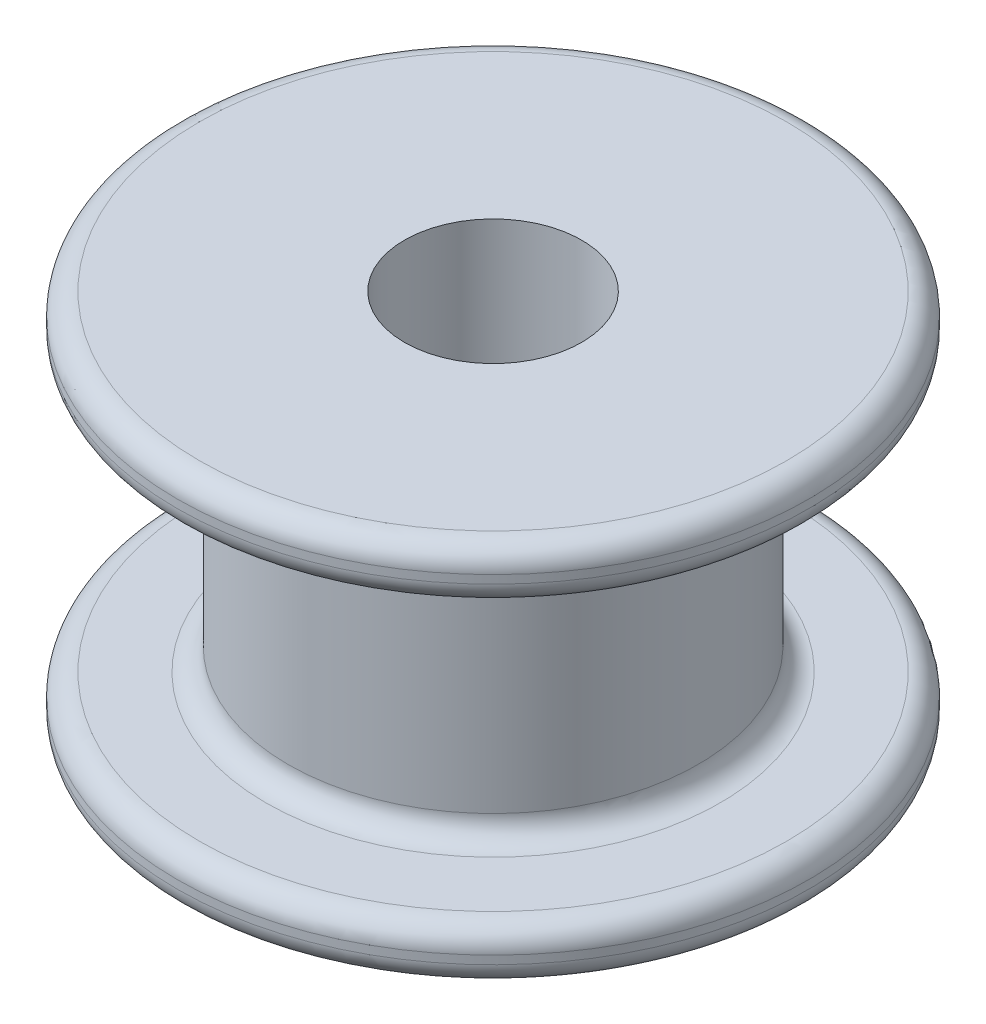
from build123d import *


with BuildPart() as part:
    # Sketch3 → Revolve1 (revolve)
    with BuildSketch(Plane(origin=(0, 0, 0), x_dir=(0, 0, -1), z_dir=(1, 0, 0))):
        with BuildLine():
            Line((8, 0), (8, 17.25))
            Line((8, 17.25), (26.5, 17.25))
            ThreePointArc((26.5, 17.25), (27.914213562, 16.664213562), (28.5, 15.25))
            Line((28.5, 15.25), (28.5, 14.5))
            ThreePointArc((28.5, 14.5), (27.914213562, 13.085786438), (26.5, 12.5))
            Line((26.5, 12.5), (20.5, 12.5))
            ThreePointArc((20.5, 12.5), (19.085786438, 11.914213562), (18.5, 10.5))
            Line((18.5, 10.5), (18.5, 0))
            Line((18.5, 0), (8, 0))
        make_face()
    revolve1 = revolve(axis=Axis((0, 18.1125, 0), (0, -1, 0)))

    # Mirror1: Revolve1 across plane
    add(revolve1.mirror(Plane(origin=(0, 0, -18.5), x_dir=(0, 0, 1), z_dir=(0, 1, 0))))


solid = part.part
